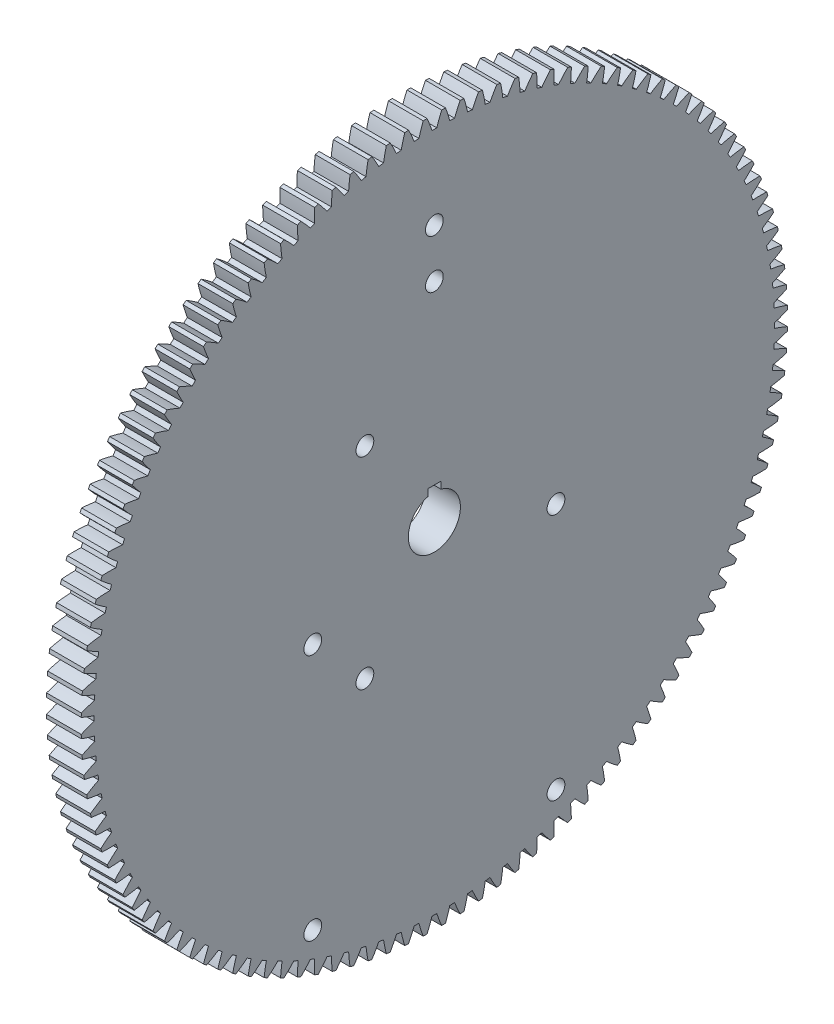
from build123d import *

# Parameters (mm, degrees)
BASPROSKE_W        = 12.7
BASPROSKE_H        = 129.116666667
TOOTHCUT_DEPTH     = 184.039660244
TEETHCUTS_COUNT    = 120
TEETHCUTS_ANGLE    = 357
BORSKE_R           = 9.525
BORE_DEPTH         = 50.8000508
KEYSKE_W           = 4.7625
KEYSKE_H           = 11.7348
KEYWAY_DEPTH       = 50.8000508
SKETCH1_R          = 3.2512
CUT_EXTRUDE1_DEPTH = 184.00052935


with BuildPart() as part:
    # BasProSke → Base-Revolve (revolve)
    with BuildSketch(Plane(origin=(0, 0, 0), x_dir=(1, 0, 0), z_dir=(0, 1, 0))):
        with Locations((6.35, 64.558333334)):
            Rectangle(BASPROSKE_W, BASPROSKE_H)
    revolve(axis=Axis((-10, 0, 0), (1, 0, 0)))

    # TooCutSke → ToothCut (cut, through all)
    with BuildSketch(Plane(origin=(0, 0, 0), x_dir=(0, 0, -1), z_dir=(1, 0, 0))):
        with BuildLine():
            ThreePointArc((0.87803111, 124.349796826), (0, 124.352896667), (-0.87803111, 124.349796826))
            ThreePointArc((-0.87803111, 124.349796826), (-1.722818551, 126.754652472), (-2.687169681, 129.114106518))
            ThreePointArc((-2.687169681, 129.114106518), (0, 129.142066667), (2.687169681, 129.114106518))
            ThreePointArc((2.687169681, 129.114106518), (1.722818551, 126.754652472), (0.87803111, 124.349796826))
        make_face()
    toothcut = extrude(amount=TOOTHCUT_DEPTH, mode=Mode.SUBTRACT)

    # TeethCuts: ToothCut ×120 about axis
    teethcuts_axis = Axis((-10, 0, 0), (1, 0, 0))
    for i in range(1, TEETHCUTS_COUNT):
        add(toothcut.rotate(teethcuts_axis, i * TEETHCUTS_ANGLE / (TEETHCUTS_COUNT - 1)), mode=Mode.SUBTRACT)

    # BorSke → Bore (cut, symmetric)
    with BuildSketch(Plane(origin=(0, 0, 0), x_dir=(0, 0, -1), z_dir=(1, 0, 0))):
        Circle(BORSKE_R)
    extrude(amount=BORE_DEPTH, both=True, mode=Mode.SUBTRACT)

    # KeySke → Keyway (cut, symmetric)
    with BuildSketch(Plane(origin=(0, 0, 0), x_dir=(0, 0, -1), z_dir=(1, 0, 0))):
        with Locations((0, 5.8674)):
            Rectangle(KEYSKE_W, KEYSKE_H)
    extrude(amount=KEYWAY_DEPTH, both=True, mode=Mode.SUBTRACT)

    # Sketch1 → Cut-Extrude1 (cut, through all)
    with BuildSketch(Plane.ZY):
        with Locations((25.4, 36.83)):
            Circle(SKETCH1_R)
        with Locations((25.4, -36.83)):
            Circle(SKETCH1_R)
        with Locations((0, 93.98)):
            Circle(SKETCH1_R)
        with Locations((0, 76.2)):
            Circle(SKETCH1_R)
        with Locations((44.45, -16.51)):
            Circle(SKETCH1_R)
        with Locations((44.45, -106.934)):
            Circle(SKETCH1_R)
        with Locations((-44.45, -106.934)):
            Circle(SKETCH1_R)
        with Locations((-44.45, -16.51)):
            Circle(SKETCH1_R)
    extrude(amount=-CUT_EXTRUDE1_DEPTH, mode=Mode.SUBTRACT)


solid = part.part
